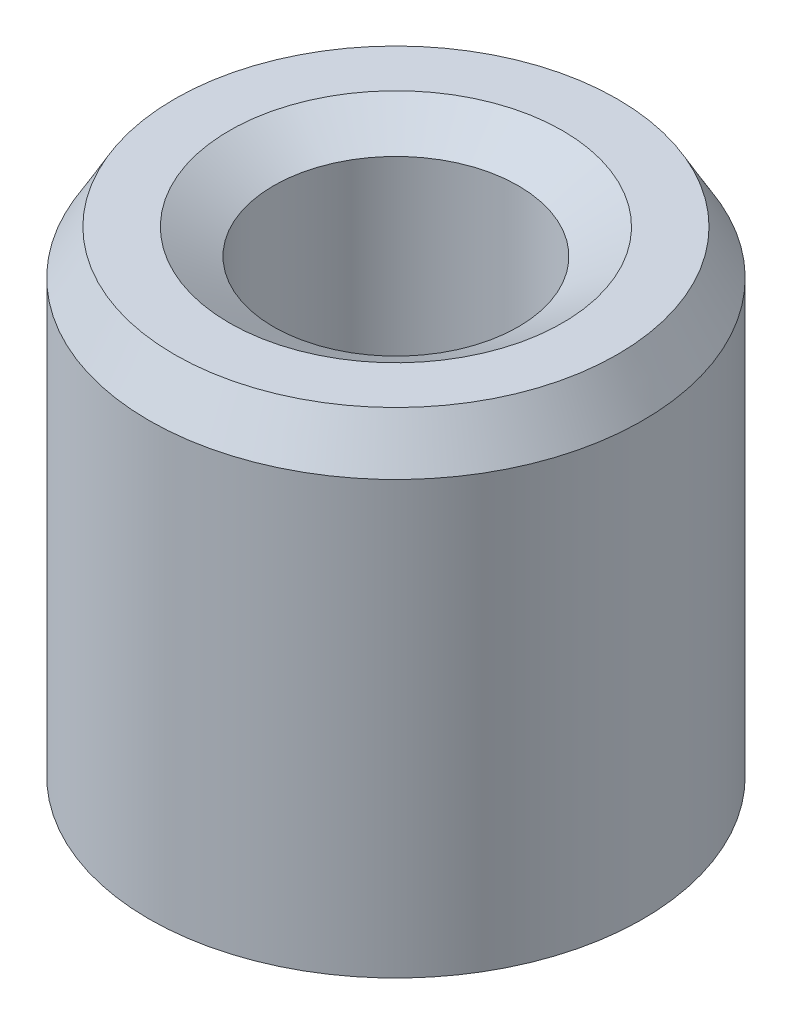
from build123d import *
from OCP.BRepFilletAPI import BRepFilletAPI_MakeChamfer

# Parameters (mm, degrees)
SKETCH1_R           = 17.5
BOSS_EXTRUDE1_DEPTH = 35.543891904
SKETCH2_R           = 8.668947468
CUT_EXTRUDE1_DEPTH  = 44.311294736
CHAMFER1_SIZE       = 3.137243872
CHAMFER1_SIZE2      = 1.811288594


with BuildPart() as part:
    # Sketch1 → Boss-Extrude1 (new body)
    with BuildSketch(Plane(origin=(0, 0, 0), x_dir=(1, 0, 0), z_dir=(0, 1, 0))):
        Circle(SKETCH1_R)
    extrude(amount=BOSS_EXTRUDE1_DEPTH)

    # Sketch2 → Cut-Extrude1 (cut, through all)
    with BuildSketch(Plane(origin=(0, 0, 0), x_dir=(1, 0, 0), z_dir=(0, 1, 0))):
        Circle(SKETCH2_R)
    extrude(amount=CUT_EXTRUDE1_DEPTH, mode=Mode.SUBTRACT)

    # Chamfer1: one chamfer whose edges measure the first distance from different faces: ONE call of the kernel's chamfer builder (chamfer() names one face for all edges)
    chamfer1_edges_1 = [part.edges().sort_by_distance(p)[0] for p in [
        (-8.668947468, 35.543891904, 0),
    ]]
    chamfer1_side_1 = [part.faces().sort_by_distance(p)[0] for p in [
        (-17.005025253, 35.543891904, 0),
    ]]
    chamfer1_edges_2 = [part.edges().sort_by_distance(p)[0] for p in [
        (-8.668947468, 0, 0),
    ]]
    chamfer1_side_2 = [part.faces().sort_by_distance(p)[0] for p in [
        (-8.668947468, 17.771945952, 0),
    ]]
    chamfer1_edges_3 = [part.edges().sort_by_distance(p)[0] for p in [
        (-17.5, 0, 0),
    ]]
    chamfer1_side_3 = [part.faces().sort_by_distance(p)[0] for p in [
        (-17.005025253, 0, 0),
    ]]
    chamfer1_edges_4 = [part.edges().sort_by_distance(p)[0] for p in [
        (-17.5, 35.543891904, 0),
    ]]
    chamfer1_side_4 = [part.faces().sort_by_distance(p)[0] for p in [
        (-17.5, 17.771945952, 0),
    ]]
    chamfer1 = BRepFilletAPI_MakeChamfer(part.part.solid().wrapped)
    for e in chamfer1_edges_1:
        chamfer1.Add(CHAMFER1_SIZE, CHAMFER1_SIZE2, e.wrapped, chamfer1_side_1[0].wrapped)  # the first distance lies on this face
    for e in chamfer1_edges_2:
        chamfer1.Add(CHAMFER1_SIZE, CHAMFER1_SIZE2, e.wrapped, chamfer1_side_2[0].wrapped)  # the first distance lies on this face
    for e in chamfer1_edges_3:
        chamfer1.Add(CHAMFER1_SIZE, CHAMFER1_SIZE2, e.wrapped, chamfer1_side_3[0].wrapped)  # the first distance lies on this face
    for e in chamfer1_edges_4:
        chamfer1.Add(CHAMFER1_SIZE, CHAMFER1_SIZE2, e.wrapped, chamfer1_side_4[0].wrapped)  # the first distance lies on this face
    add(Compound.cast(chamfer1.Shape()), mode=Mode.REPLACE)


solid = part.part
